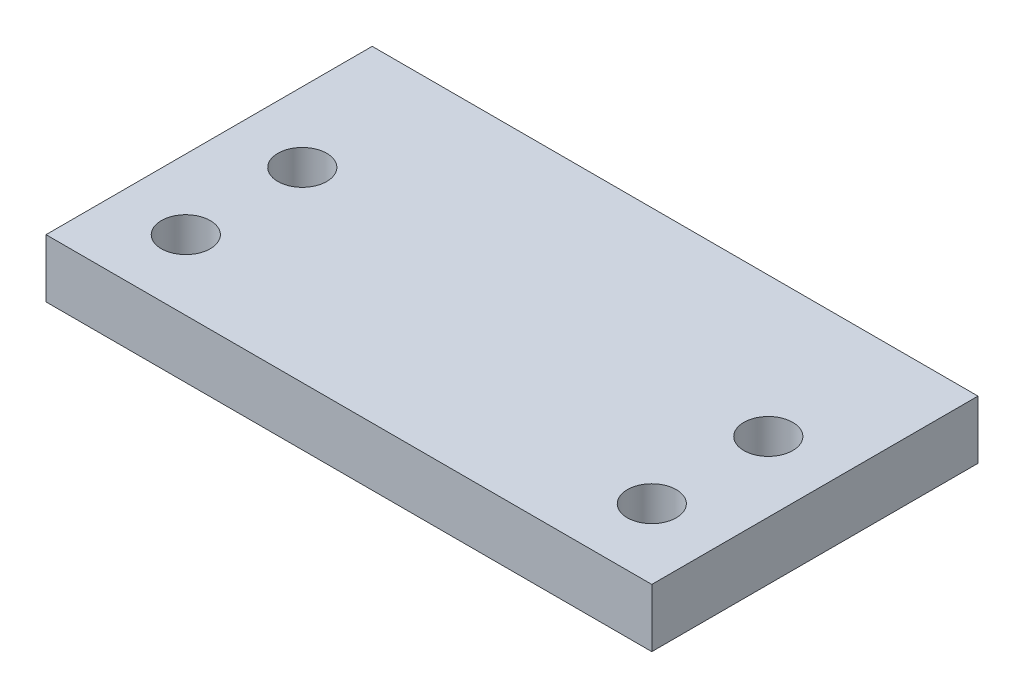
from build123d import *

# Parameters (mm, degrees)
SKETCH1_W           = 52
SKETCH1_H           = 28
SKETCH1_R           = 2.1
BOSS_EXTRUDE1_DEPTH = 5


with BuildPart() as part:
    # Sketch1 → Boss-Extrude1 (new body)
    with BuildSketch(Plane(origin=(0, 0, 0), x_dir=(1, 0, 0), z_dir=(0, 1, 0))):
        Rectangle(SKETCH1_W, SKETCH1_H)
        with Locations((20, -8)):
            Circle(SKETCH1_R, mode=Mode.SUBTRACT)
        with Locations((20, 2)):
            Circle(SKETCH1_R, mode=Mode.SUBTRACT)
        with Locations((-20, -8)):
            Circle(SKETCH1_R, mode=Mode.SUBTRACT)
        with Locations((-20, 2)):
            Circle(SKETCH1_R, mode=Mode.SUBTRACT)
    extrude(amount=BOSS_EXTRUDE1_DEPTH)


solid = part.part
